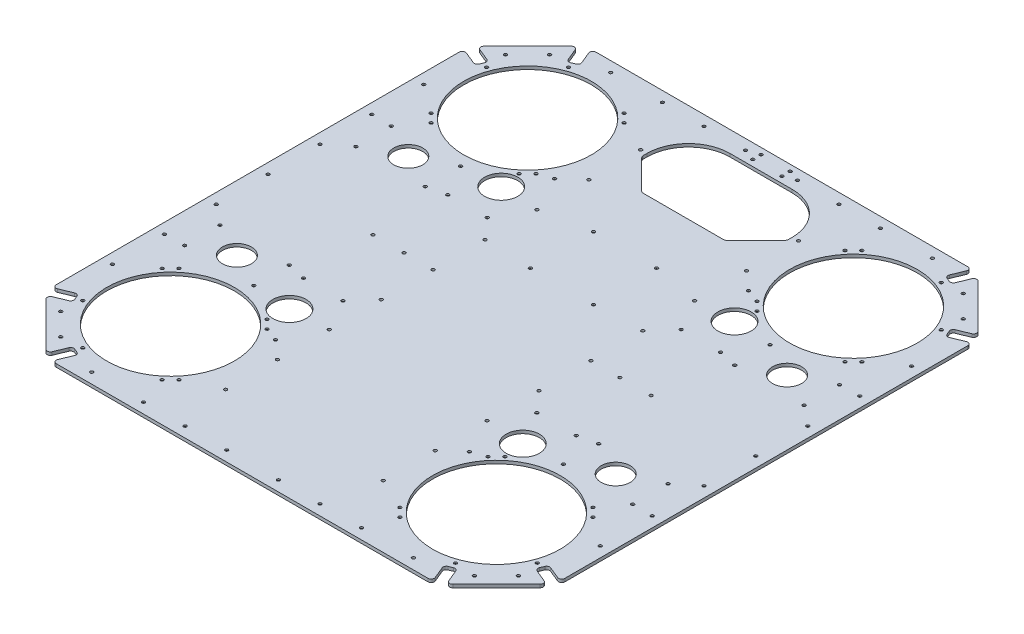
from build123d import *

# Parameters (mm, degrees)
SKETCH_1_W               = 490
SKETCH_1_H               = 520
EXTRUDE_1_DEPTH          = 3
SKETCH_2_R               = 61.5
SKETCH_2_R_2             = 14
SKETCH_2_R_3             = 1.5
SKETCH_2_R_4             = 16
CUT_EXTRUDE_1_DEPTH      = 4
CHAMFER_1_SIZE           = 1.5
CHAMFER_2_SIZE           = 56
SKETCH_3_R               = 1.5
SKETCH_3_W               = 140
SKETCH_3_H               = 75
CUT_EXTRUDE_2_DEPTH      = 358.259009683
FILLET_1_R               = 40
CHAMFER_3_SIZE           = 30
FILLET_2_R               = 3
SKETCH_4_R               = 1.5
CUT_EXTRUDE_3_DEPTH      = 358.259009683
SKETCH_5_R               = 1.5
CUT_EXTRUDE_4_DEPTH      = 358.259009683
CHAMFER_4_SIZE           = 1.5
CUT_EXTRUDE_5_DEPTH      = 3
FILLET_3_R               = 3
SKETCH_7_R               = 1.5
CUT_EXTRUDE_6_DEPTH      = 3
CUT_EXTRUDE_7_DEPTH      = 358.259009683
CUT_EXTRUDE_7_DEPTH_BACK = 358.259009683
SKETCH_8_R               = 1.5
CHAMFER_5_SIZE           = 1.5
SKETCH_9_R               = 1.5
CUT_EXTRUDE_8_DEPTH      = 358.259009683
SKETCH_10_R              = 1.5
CUT_EXTRUDE_9_DEPTH      = 358.259009683


with BuildPart() as part:
    # 草图1 → 凸台-拉伸1 (new body)
    with BuildSketch(Plane(origin=(0, 0, 0), x_dir=(1, 0, 0), z_dir=(0, 1, 0))):
        Rectangle(SKETCH_1_W, SKETCH_1_H)
    extrude(amount=EXTRUDE_1_DEPTH)

    # 草图2 → 切除-拉伸1 (cut)
    with BuildSketch(Plane(origin=(0, 3, 0), x_dir=(1, 0, 0), z_dir=(0, 1, 0))):
        with Locations((157, -172)):
            Circle(SKETCH_2_R)
        with Locations((182.5, -82.564268885)):
            Circle(SKETCH_2_R_2)
        with Locations((215.912744657, -65.539625145)):
            Circle(SKETCH_2_R_3)
        with Locations((215.912744657, -99.588912626)):
            Circle(SKETCH_2_R_3)
        with Locations((199.423982239, -121.441066754)):
            Circle(SKETCH_2_R_3)
        with Locations((207.558933246, -129.576017761)):
            Circle(SKETCH_2_R_3)
        with Locations((114.576017761, -222.558933246)):
            Circle(SKETCH_2_R_3)
        with Locations((106.441066754, -214.423982239)):
            Circle(SKETCH_2_R_3)
        with Locations((106.441066754, -129.576017761)):
            Circle(SKETCH_2_R_3)
        with Locations((114.576017761, -121.441066754)):
            Circle(SKETCH_2_R_3)
        with Locations((179.573329459, -234.019712972)):
            Circle(SKETCH_2_R_3)
        with Locations((219.019712972, -194.573329459)):
            Circle(SKETCH_2_R_3)
        with Locations((-219.019712972, -194.573329459)):
            Circle(SKETCH_2_R_3)
        with Locations((-179.573329459, -234.019712972)):
            Circle(SKETCH_2_R_3)
        with Locations((-114.576017761, -121.441066754)):
            Circle(SKETCH_2_R_3)
        with Locations((-106.441066754, -129.576017761)):
            Circle(SKETCH_2_R_3)
        with Locations((-106.441066754, -214.423982239)):
            Circle(SKETCH_2_R_3)
        with Locations((-114.576017761, -222.558933246)):
            Circle(SKETCH_2_R_3)
        with Locations((-207.558933246, -129.576017761)):
            Circle(SKETCH_2_R_3)
        with Locations((-199.423982239, -121.441066754)):
            Circle(SKETCH_2_R_3)
        with Locations((-215.912744657, -99.588912626)):
            Circle(SKETCH_2_R_3)
        with Locations((-215.912744657, -65.539625145)):
            Circle(SKETCH_2_R_3)
        with Locations((-182.5, -82.564268885)):
            Circle(SKETCH_2_R_2)
        with Locations((-157, -172)):
            Circle(SKETCH_2_R)
        with Locations((-157, 172)):
            Circle(SKETCH_2_R)
        with Locations((-182.5, 82.564268885)):
            Circle(SKETCH_2_R_2)
        with Locations((-215.912744657, 65.539625145)):
            Circle(SKETCH_2_R_3)
        with Locations((-215.912744657, 99.588912626)):
            Circle(SKETCH_2_R_3)
        with Locations((-199.423982239, 121.441066754)):
            Circle(SKETCH_2_R_3)
        with Locations((-207.558933246, 129.576017761)):
            Circle(SKETCH_2_R_3)
        with Locations((-114.576017761, 222.558933246)):
            Circle(SKETCH_2_R_3)
        with Locations((-106.441066754, 214.423982239)):
            Circle(SKETCH_2_R_3)
        with Locations((-106.441066754, 129.576017761)):
            Circle(SKETCH_2_R_3)
        with Locations((-114.576017761, 121.441066754)):
            Circle(SKETCH_2_R_3)
        with Locations((-179.573329459, 234.019712972)):
            Circle(SKETCH_2_R_3)
        with Locations((-219.019712972, 194.573329459)):
            Circle(SKETCH_2_R_3)
        with Locations((219.019712972, 194.573329459)):
            Circle(SKETCH_2_R_3)
        with Locations((179.573329459, 234.019712972)):
            Circle(SKETCH_2_R_3)
        with Locations((114.576017761, 121.441066754)):
            Circle(SKETCH_2_R_3)
        with Locations((106.441066754, 129.576017761)):
            Circle(SKETCH_2_R_3)
        with Locations((106.441066754, 214.423982239)):
            Circle(SKETCH_2_R_3)
        with Locations((114.576017761, 222.558933246)):
            Circle(SKETCH_2_R_3)
        with Locations((207.558933246, 129.576017761)):
            Circle(SKETCH_2_R_3)
        with Locations((199.423982239, 121.441066754)):
            Circle(SKETCH_2_R_3)
        with Locations((215.912744657, 99.588912626)):
            Circle(SKETCH_2_R_3)
        with Locations((215.912744657, 65.539625145)):
            Circle(SKETCH_2_R_3)
        with Locations((182.5, 82.564268885)):
            Circle(SKETCH_2_R_2)
        with Locations((157, 172)):
            Circle(SKETCH_2_R)
        with Locations((149.087255343, -99.588912626)):
            Circle(SKETCH_2_R_3)
        with Locations((149.087255343, -65.539625145)):
            Circle(SKETCH_2_R_3)
        with Locations((-149.087255343, -99.588912626)):
            Circle(SKETCH_2_R_3)
        with Locations((-149.087255343, -65.539625145)):
            Circle(SKETCH_2_R_3)
        with Locations((149.087255343, 99.588912626)):
            Circle(SKETCH_2_R_3)
        with Locations((149.087255343, 65.539625145)):
            Circle(SKETCH_2_R_3)
        with Locations((-149.087255343, 99.588912626)):
            Circle(SKETCH_2_R_3)
        with Locations((-149.087255343, 65.539625145)):
            Circle(SKETCH_2_R_3)
        with Locations((112.401793758, -102)):
            Circle(SKETCH_2_R_4)
        with Locations((-112.401793758, -102)):
            Circle(SKETCH_2_R_4)
        with Locations((112.401793758, 102)):
            Circle(SKETCH_2_R_4)
        with Locations((-112.401793758, 102)):
            Circle(SKETCH_2_R_4)
    extrude(amount=-CUT_EXTRUDE_1_DEPTH, mode=Mode.SUBTRACT)

    # 倒角1
    chamfer_1_edges = [part.edges().sort_by_distance(p)[0] for p in [
        (-209.058933246, 0, 129.576017761),
        (-200.923982239, 0, 121.441066754),
        (-220.519712972, 0, 194.573329459),
        (-181.073329459, 0, 234.019712972),
        (-116.076017761, 0, 222.558933246),
        (-107.941066754, 0, 214.423982239),
        (-107.941066754, 0, 129.576017761),
        (-116.076017761, 0, 121.441066754),
        (-217.412744657, 0, 65.539625145),
        (-217.412744657, 0, 99.588912626),
        (-220.519712972, 0, -194.573329459),
        (-181.073329459, 0, -234.019712972),
        (-116.076017761, 0, -222.558933246),
        (-107.941066754, 0, -214.423982239),
        (-107.941066754, 0, -129.576017761),
        (-116.076017761, 0, -121.441066754),
        (-209.058933246, 0, -129.576017761),
        (-200.923982239, 0, -121.441066754),
        (-217.412744657, 0, -99.588912626),
        (-217.412744657, 0, -65.539625145),
        (206.058933246, 0, -129.576017761),
        (197.923982239, 0, -121.441066754),
        (217.519712972, 0, -194.573329459),
        (178.073329459, 0, -234.019712972),
        (113.076017761, 0, -222.558933246),
        (104.941066754, 0, -214.423982239),
        (104.941066754, 0, -129.576017761),
        (113.076017761, 0, -121.441066754),
        (214.412744657, 0, -65.539625145),
        (214.412744657, 0, -99.588912626),
        (214.412744657, 0, 99.588912626),
        (214.412744657, 0, 65.539625145),
        (104.941066754, 0, 129.576017761),
        (113.076017761, 0, 121.441066754),
        (197.923982239, 0, 121.441066754),
        (206.058933246, 0, 129.576017761),
        (178.073329459, 0, 234.019712972),
        (217.519712972, 0, 194.573329459),
        (104.941066754, 0, 214.423982239),
        (113.076017761, 0, 222.558933246),
        (-150.587255343, 0, -65.539625145),
        (-150.587255343, 0, -99.588912626),
        (147.587255343, 0, -65.539625145),
        (147.587255343, 0, -99.588912626),
        (147.587255343, 0, 99.588912626),
        (147.587255343, 0, 65.539625145),
        (-150.587255343, 0, 99.588912626),
        (-150.587255343, 0, 65.539625145),
    ]]
    chamfer(chamfer_1_edges, length=CHAMFER_1_SIZE)

    # 倒角2
    chamfer_2_edges = [part.edges().sort_by_distance(p)[0] for p in [
        (-245, 1.5, 260),
        (245, 1.5, 260),
        (245, 1.5, -260),
        (-245, 1.5, -260),
    ]]
    chamfer(chamfer_2_edges, length=CHAMFER_2_SIZE)

    # 草图3 → 切除-拉伸2 (cut, through all)
    with BuildSketch(Plane(origin=(0, 3, 0), x_dir=(1, 0, 0), z_dir=(0, 1, 0))):
        with Locations((-14, 254)):
            Circle(SKETCH_3_R)
        with Locations((-14, 246)):
            Circle(SKETCH_3_R)
        with Locations((14, 246)):
            Circle(SKETCH_3_R)
        with Locations((14, 254)):
            Circle(SKETCH_3_R)
        with Locations((0, 202.5)):
            Rectangle(SKETCH_3_W, SKETCH_3_H)
    extrude(amount=-CUT_EXTRUDE_2_DEPTH, mode=Mode.SUBTRACT)

    # 圆角1
    fillet_1_edges = [part.edges().sort_by_distance(p)[0] for p in [
        (-70, 1.5, -240),
        (70, 1.5, -240),
    ]]
    fillet(fillet_1_edges, radius=FILLET_1_R)

    # 倒角3
    chamfer_3_edges = [part.edges().sort_by_distance(p)[0] for p in [
        (70, 1.5, -165),
        (-70, 1.5, -165),
    ]]
    chamfer(chamfer_3_edges, length=CHAMFER_3_SIZE)

    # 圆角2
    fillet_2_edges = [part.edges().sort_by_distance(p)[0] for p in [
        (40, 1.5, -165),
        (70, 1.5, -195),
        (-40, 1.5, -165),
        (-70, 1.5, -195),
    ]]
    fillet(fillet_2_edges, radius=FILLET_2_R)

    # 草图4 → 切除-拉伸3 (cut, through all)
    with BuildSketch(Plane(origin=(0, 3, 0), x_dir=(1, 0, 0), z_dir=(0, 1, 0))):
        with Locations((-235, 50)):
            Circle(SKETCH_4_R)
        with Locations((-235, 100)):
            Circle(SKETCH_4_R)
        with Locations((-235, 150)):
            Circle(SKETCH_4_R)
        with Locations((-235, 200)):
            Circle(SKETCH_4_R)
        with Locations((-235, -200)):
            Circle(SKETCH_4_R)
        with Locations((-235, -150)):
            Circle(SKETCH_4_R)
        with Locations((-235, -100)):
            Circle(SKETCH_4_R)
        with Locations((-235, -50)):
            Circle(SKETCH_4_R)
        with Locations((-25, 250)):
            Circle(SKETCH_4_R)
        with Locations((-65, 250)):
            Circle(SKETCH_4_R)
        with Locations((-105, 250)):
            Circle(SKETCH_4_R)
        with Locations((-105, -250)):
            Circle(SKETCH_4_R)
        with Locations((-65, -250)):
            Circle(SKETCH_4_R)
        with Locations((-25, -250)):
            Circle(SKETCH_4_R)
        with Locations((25, -250)):
            Circle(SKETCH_4_R)
        with Locations((65, -250)):
            Circle(SKETCH_4_R)
        with Locations((105, -250)):
            Circle(SKETCH_4_R)
        with Locations((105, 250)):
            Circle(SKETCH_4_R)
        with Locations((65, 250)):
            Circle(SKETCH_4_R)
        with Locations((25, 250)):
            Circle(SKETCH_4_R)
        with Locations((235, -50)):
            Circle(SKETCH_4_R)
        with Locations((235, -100)):
            Circle(SKETCH_4_R)
        with Locations((235, -150)):
            Circle(SKETCH_4_R)
        with Locations((235, -200)):
            Circle(SKETCH_4_R)
        with Locations((235, 200)):
            Circle(SKETCH_4_R)
        with Locations((235, 150)):
            Circle(SKETCH_4_R)
        with Locations((235, 100)):
            Circle(SKETCH_4_R)
        with Locations((235, 50)):
            Circle(SKETCH_4_R)
        with Locations((-235, 0)):
            Circle(SKETCH_4_R)
        with Locations((235, 0)):
            Circle(SKETCH_4_R)
        with Locations((-155, 250)):
            Circle(SKETCH_4_R)
        with Locations((155, 250)):
            Circle(SKETCH_4_R)
        with Locations((155, -250)):
            Circle(SKETCH_4_R)
        with Locations((-155, -250)):
            Circle(SKETCH_4_R)
    extrude(amount=-CUT_EXTRUDE_3_DEPTH, mode=Mode.SUBTRACT)

    # 草图5 → 切除-拉伸4 (cut, through all)
    with BuildSketch(Plane(origin=(0, 3, 0), x_dir=(1, 0, 0), z_dir=(0, 1, 0))):
        with Locations((-199.32233047, 235.535533906)):
            Circle(SKETCH_5_R)
        with Locations((-220.535533906, 214.32233047)):
            Circle(SKETCH_5_R)
        with Locations((220.535533906, 214.32233047)):
            Circle(SKETCH_5_R)
        with Locations((199.32233047, 235.535533906)):
            Circle(SKETCH_5_R)
        with Locations((199.32233047, -235.535533906)):
            Circle(SKETCH_5_R)
        with Locations((220.535533906, -214.32233047)):
            Circle(SKETCH_5_R)
        with Locations((-220.535533906, -214.32233047)):
            Circle(SKETCH_5_R)
        with Locations((-199.32233047, -235.535533906)):
            Circle(SKETCH_5_R)
    extrude(amount=-CUT_EXTRUDE_4_DEPTH, mode=Mode.SUBTRACT)

    # 倒角4
    chamfer_4_edges = [part.edges().sort_by_distance(p)[0] for p in [
        (-236.5, 0, 200),
        (-236.5, 0, 150),
        (-236.5, 0, 100),
        (-236.5, 0, 50),
        (-236.5, 0, 0),
        (-236.5, 0, -50),
        (-236.5, 0, -100),
        (-236.5, 0, -150),
        (-236.5, 0, -200),
        (-222.035533906, 0, -214.32233047),
        (-200.82233047, 0, -235.535533906),
        (-106.5, 0, -250),
        (-66.5, 0, -250),
        (-26.5, 0, -250),
        (23.5, 0, -250),
        (63.5, 0, -250),
        (103.5, 0, -250),
        (197.82233047, 0, -235.535533906),
        (219.035533906, 0, -214.32233047),
        (233.5, 0, -200),
        (233.5, 0, -150),
        (233.5, 0, -100),
        (233.5, 0, -50),
        (233.5, 0, 0),
        (233.5, 0, 50),
        (233.5, 0, 100),
        (233.5, 0, 150),
        (233.5, 0, 200),
        (219.035533906, 0, 214.32233047),
        (197.82233047, 0, 235.535533906),
        (103.5, 0, 250),
        (63.5, 0, 250),
        (23.5, 0, 250),
        (-26.5, 0, 250),
        (-66.5, 0, 250),
        (-106.5, 0, 250),
        (-222.035533906, 0, 214.32233047),
        (-200.82233047, 0, 235.535533906),
        (12.5, 0, -254),
        (12.5, 0, -246),
        (-15.5, 0, -246),
        (-15.5, 0, -254),
    ]]
    chamfer(chamfer_4_edges, length=CHAMFER_4_SIZE)

    # 草图6 → 切除-拉伸5 (cut)
    with BuildSketch(Plane.XZ):
        Polygon((-263.088231786, 206.080429923), (-226.588067447, 190.961566825), (-222.761233123, 200.200362151), (-259.261397462, 215.319225249), align=None)
        Polygon((-191.080429923, 278.088231786), (-175.961566825, 241.588067447), (-185.200362151, 237.761233123), (-200.319225249, 274.261397462), align=None)
        Polygon((263.088231786, 206.080429923), (226.588067447, 190.961566825), (222.761233123, 200.200362151), (259.261397462, 215.319225249), align=None)
        Polygon((191.080429923, 278.088231786), (200.319225249, 274.261397462), (185.200362151, 237.761233123), (175.961566825, 241.588067447), align=None)
        Polygon((191.080429923, -278.088231786), (175.961566825, -241.588067447), (185.200362151, -237.761233123), (200.319225249, -274.261397462), align=None)
        Polygon((263.088231786, -206.080429923), (259.261397462, -215.319225249), (222.761233123, -200.200362151), (226.588067447, -190.961566825), align=None)
        Polygon((-191.080429923, -278.088231786), (-200.319225249, -274.261397462), (-185.200362151, -237.761233123), (-175.961566825, -241.588067447), align=None)
        Polygon((-263.088231786, -206.080429923), (-259.261397462, -215.319225249), (-222.761233123, -200.200362151), (-226.588067447, -190.961566825), align=None)
    extrude(amount=-CUT_EXTRUDE_5_DEPTH, mode=Mode.SUBTRACT)

    # 圆角3
    fillet_3_edges = [part.edges().sort_by_distance(p)[0] for p in [
        (-245, 1.5, 198.588038999),
        (-241.173165676, 1.5, 207.826834324),
        (-226.588067447, 1.5, 190.961566825),
        (-222.761233123, 1.5, 200.200362151),
        (-245, 1.5, -198.588038999),
        (-241.173165676, 1.5, -207.826834324),
        (-222.761233123, 1.5, -200.200362151),
        (-226.588067447, 1.5, -190.961566825),
        (-183.588038999, 1.5, -260),
        (-192.826834324, 1.5, -256.173165676),
        (-175.961566825, 1.5, -241.588067447),
        (-185.200362151, 1.5, -237.761233123),
        (183.588038999, 1.5, -260),
        (192.826834324, 1.5, -256.173165676),
        (185.200362151, 1.5, -237.761233123),
        (175.961566825, 1.5, -241.588067447),
        (241.173165676, 1.5, -207.826834324),
        (245, 1.5, -198.588038999),
        (222.761233123, 1.5, -200.200362151),
        (226.588067447, 1.5, -190.961566825),
        (241.173165676, 1.5, 207.826834324),
        (245, 1.5, 198.588038999),
        (226.588067447, 1.5, 190.961566825),
        (222.761233123, 1.5, 200.200362151),
        (192.826834324, 1.5, 256.173165676),
        (183.588038999, 1.5, 260),
        (175.961566825, 1.5, 241.588067447),
        (185.200362151, 1.5, 237.761233123),
        (-183.588038999, 1.5, 260),
        (-192.826834324, 1.5, 256.173165676),
        (-175.961566825, 1.5, 241.588067447),
        (-185.200362151, 1.5, 237.761233123),
    ]]
    fillet(fillet_3_edges, radius=FILLET_3_R)

    # 草图7 → 切除-拉伸6 (cut)
    with BuildSketch(Plane(origin=(0, 3, 0), x_dir=(1, 0, 0), z_dir=(0, 1, 0))):
        with Locations((131.401793758, 69.5)):
            Circle(SKETCH_7_R)
        with Locations((93.401793758, 69.5)):
            Circle(SKETCH_7_R)
        with Locations((93.401793758, 134.5)):
            Circle(SKETCH_7_R)
        with Locations((-93.401793758, 134.5)):
            Circle(SKETCH_7_R)
        with Locations((-93.401793758, 69.5)):
            Circle(SKETCH_7_R)
        with Locations((-131.401793758, 69.5)):
            Circle(SKETCH_7_R)
        with Locations((-131.401793758, -69.5)):
            Circle(SKETCH_7_R)
        with Locations((-93.401793758, -69.5)):
            Circle(SKETCH_7_R)
        with Locations((-93.401793758, -134.5)):
            Circle(SKETCH_7_R)
        with Locations((93.401793758, -134.5)):
            Circle(SKETCH_7_R)
        with Locations((93.401793758, -69.5)):
            Circle(SKETCH_7_R)
        with Locations((131.401793758, -69.5)):
            Circle(SKETCH_7_R)
    extrude(amount=-CUT_EXTRUDE_6_DEPTH, mode=Mode.SUBTRACT)

    # 草图8 → 切除-拉伸7 (cut, two sides: drawn at the far end of the back side and taken through both)
    with BuildSketch(Plane(origin=(0, 3, 0), x_dir=(1, 0, 0), z_dir=(0, 1, 0)).offset(-CUT_EXTRUDE_7_DEPTH_BACK)):
        with Locations((-30.4, 108.9)):
            Circle(SKETCH_8_R)
        with Locations((-30.4, 48.1)):
            Circle(SKETCH_8_R)
        with Locations((30.4, 48.1)):
            Circle(SKETCH_8_R)
        with Locations((30.4, 108.9)):
            Circle(SKETCH_8_R)
    extrude(amount=CUT_EXTRUDE_7_DEPTH + CUT_EXTRUDE_7_DEPTH_BACK, mode=Mode.SUBTRACT)

    # 倒角5
    chamfer_5_edges = [part.edges().sort_by_distance(p)[0] for p in [
        (-132.901793758, 0, 69.5),
        (-94.901793758, 0, 69.5),
        (-94.901793758, 0, 134.5),
        (91.901793758, 0, 134.5),
        (91.901793758, 0, 69.5),
        (129.901793758, 0, 69.5),
        (91.901793758, 0, -69.5),
        (129.901793758, 0, -69.5),
        (91.901793758, 0, -134.5),
        (-94.901793758, 0, -134.5),
        (-132.901793758, 0, -69.5),
        (-94.901793758, 0, -69.5),
        (-31.9, 0, -48.1),
        (28.9, 0, -48.1),
        (-31.9, 0, -108.9),
        (28.9, 0, -108.9),
    ]]
    chamfer(chamfer_5_edges, length=CHAMFER_5_SIZE)

    # 草图9 → 切除-拉伸8 (cut, through all)
    with BuildSketch(Plane(origin=(0, 3, 0), x_dir=(1, 0, 0), z_dir=(0, 1, 0))):
        with Locations((-104, 0)):
            Circle(SKETCH_9_R)
        with Locations((-134, 0)):
            Circle(SKETCH_9_R)
        with Locations((134, 0)):
            Circle(SKETCH_9_R)
        with Locations((104, 0)):
            Circle(SKETCH_9_R)
    extrude(amount=-CUT_EXTRUDE_8_DEPTH, mode=Mode.SUBTRACT)

    # 草图10 → 切除-拉伸9 (cut, through all)
    with BuildSketch(Plane(origin=(0, 3, 0), x_dir=(1, 0, 0), z_dir=(0, 1, 0))):
        with Locations((-76, 0)):
            Circle(SKETCH_10_R)
        with Locations((-76, 50)):
            Circle(SKETCH_10_R)
        with Locations((-76, 100)):
            Circle(SKETCH_10_R)
        with Locations((-76, 150)):
            Circle(SKETCH_10_R)
        with Locations((-76, 200)):
            Circle(SKETCH_10_R)
        with Locations((-76, -200)):
            Circle(SKETCH_10_R)
        with Locations((-76, -150)):
            Circle(SKETCH_10_R)
        with Locations((-76, -100)):
            Circle(SKETCH_10_R)
        with Locations((-76, -50)):
            Circle(SKETCH_10_R)
        with Locations((76, -50)):
            Circle(SKETCH_10_R)
        with Locations((76, -100)):
            Circle(SKETCH_10_R)
        with Locations((76, -150)):
            Circle(SKETCH_10_R)
        with Locations((76, -200)):
            Circle(SKETCH_10_R)
        with Locations((76, 200)):
            Circle(SKETCH_10_R)
        with Locations((76, 150)):
            Circle(SKETCH_10_R)
        with Locations((76, 100)):
            Circle(SKETCH_10_R)
        with Locations((76, 50)):
            Circle(SKETCH_10_R)
        with Locations((76, 0)):
            Circle(SKETCH_10_R)
    extrude(amount=-CUT_EXTRUDE_9_DEPTH, mode=Mode.SUBTRACT)


solid = part.part
